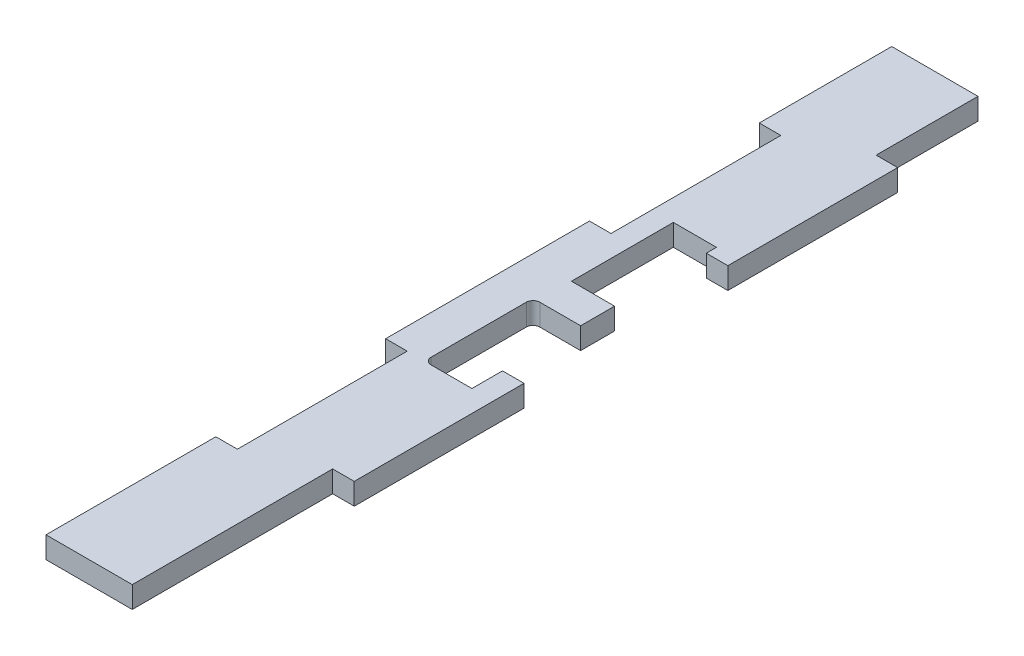
from build123d import *

# Parameters (mm, degrees)
BOSS_EXTRUDE1_DEPTH = 6.35
SKETCH3_W           = 14
SKETCH3_H           = 32
SKETCH3_W_2         = 12.7
SKETCH3_H_2         = 30
CUT_EXTRUDE1_DEPTH  = 252.096365963
FILLET1_R           = 2
SKETCH4_W           = 6.35
SKETCH4_H           = 50
CUT_EXTRUDE2_DEPTH  = 252.096365963


with BuildPart() as part:
    # Sketch2 → Boss-Extrude1 (new body)
    with BuildSketch(Plane(origin=(0, 0, 0), x_dir=(1, 0, 0), z_dir=(0, 1, 0))):
        Polygon((0, 0), (25.4, 0), (25.4, 59), (31.75, 59), (31.75, 109), (25.4, 109), (25.4, 169), (31.75, 169), (31.75, 219), (25.4, 219), (25.4, 249), (0, 249), align=None)
    extrude(amount=BOSS_EXTRUDE1_DEPTH)

    # Sketch3 → Cut-Extrude1 (cut, through all)
    with BuildSketch(Plane(origin=(0, 6.35, 0), x_dir=(1, 0, 0), z_dir=(0, 1, 0))):
        with Locations((18.4, 116)):
            Rectangle(SKETCH3_W, SKETCH3_H)
        with Locations((19.05, 157)):
            Rectangle(SKETCH3_W_2, SKETCH3_H_2)
    extrude(amount=-CUT_EXTRUDE1_DEPTH, mode=Mode.SUBTRACT)

    # Fillet1
    fillet1_edges = [part.edges().sort_by_distance(p)[0] for p in [
        (11.4, 3.175, -100),
        (11.4, 3.175, -132),
    ]]
    fillet(fillet1_edges, radius=FILLET1_R)

    # Sketch4 → Cut-Extrude2 (cut, through all)
    with BuildSketch(Plane(origin=(0, 6.35, 0), x_dir=(1, 0, 0), z_dir=(0, 1, 0))):
        with Locations((3.175, 75)):
            Rectangle(SKETCH4_W, SKETCH4_H)
        with Locations((3.175, 185)):
            Rectangle(SKETCH4_W, SKETCH4_H)
    extrude(amount=-CUT_EXTRUDE2_DEPTH, mode=Mode.SUBTRACT)


solid = part.part
